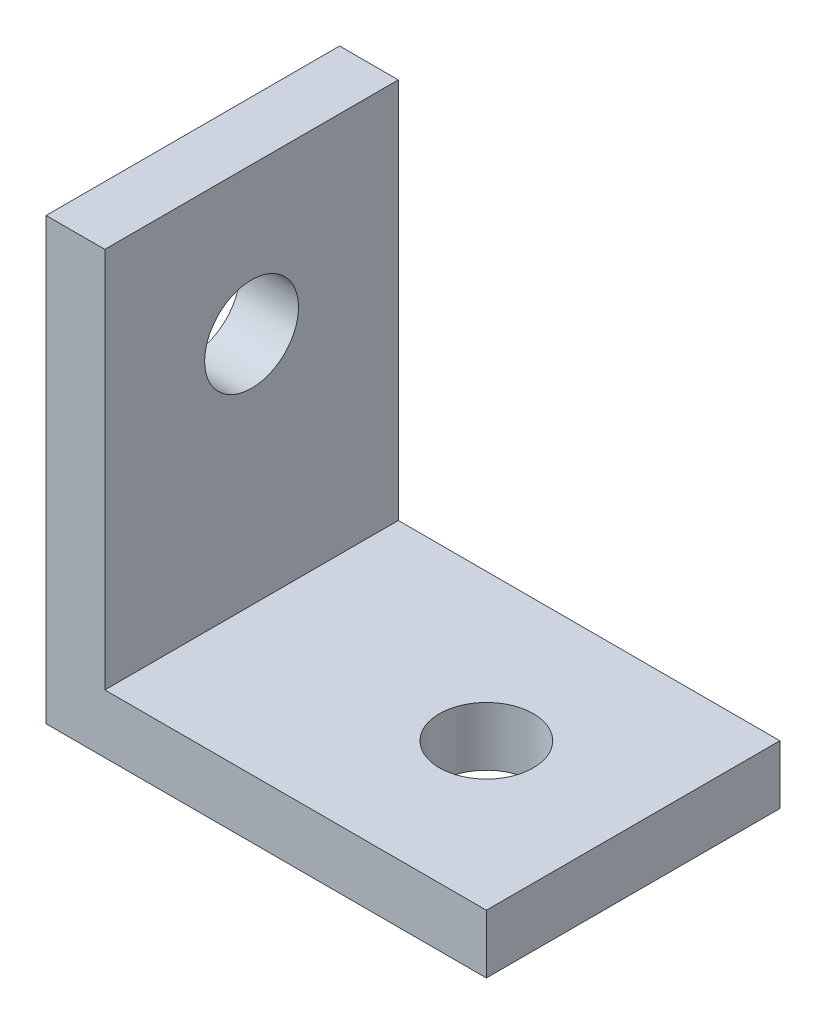
from build123d import *

# Parameters (mm, degrees)
BASE_DEPTH                           = 5
F_3_2_3_2_DIAMETER_HOLE1_D           = 3.2
F_3_2_3_2_DIAMETER_HOLE1_ON_FACE_2_D = 3.2


with BuildPart() as part:
    # Sketch1 → Base (new, symmetric)
    with BuildSketch(Plane.XY):
        Polygon((0, 0), (0, 15), (2, 15), (2, 2), (15, 2), (15, 0), align=None)
    extrude(amount=BASE_DEPTH, both=True)

    # Ø3.2 (3.2) Diameter Hole1 (through all)
    with Locations(Plane(origin=(0, 10, 0), x_dir=(0, 0, -1), z_dir=(-1, 0, 0))):
        with Locations((0, 0)):
            Hole(F_3_2_3_2_DIAMETER_HOLE1_D / 2)

    # Ø3.2 (3.2) Diameter Hole1 on face 2 (through all)
    with Locations(Plane(origin=(10, 0, 0), x_dir=(0, 0, -1), z_dir=(0, -1, 0))):
        with Locations((0, 0)):
            Hole(F_3_2_3_2_DIAMETER_HOLE1_ON_FACE_2_D / 2)


solid = part.part
